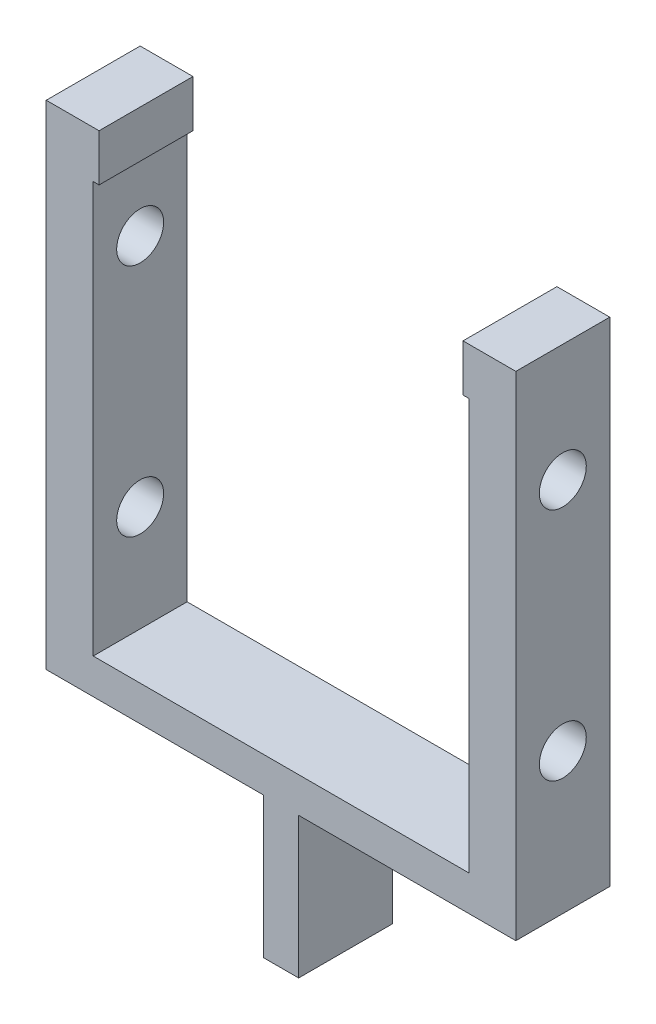
from build123d import *

# Parameters (mm, degrees)
BOSS_EXTRUDE1_DEPTH = 12.7
SKETCH2_R           = 6.35
CUT_EXTRUDE1_DEPTH  = 214.741415032


with BuildPart() as part:
    # Sketch1 → Boss-Extrude1 (new, symmetric)
    with BuildSketch(Plane.XY):
        Polygon((4.7625, 0), (-4.7625, 0), (-4.7625, 38.1), (-63.5, 38.1), (-63.5, 171.45), (-49.2125, 171.45), (-49.2125, 158.75), (-50.8, 158.75), (-50.8, 47.625), (50.8, 47.625), (50.8, 158.75), (49.2125, 158.75), (49.2125, 171.45), (63.5, 171.45), (63.5, 38.1), (4.7625, 38.1), align=None)
    extrude(amount=BOSS_EXTRUDE1_DEPTH, both=True)

    # Sketch2 → Cut-Extrude1 (cut, through all)
    with BuildSketch(Plane.ZY.offset(63.5)):
        with Locations((0, 76.2)):
            Circle(SKETCH2_R)
        with Locations((0, 139.7)):
            Circle(SKETCH2_R)
    extrude(amount=-CUT_EXTRUDE1_DEPTH, mode=Mode.SUBTRACT)


solid = part.part
